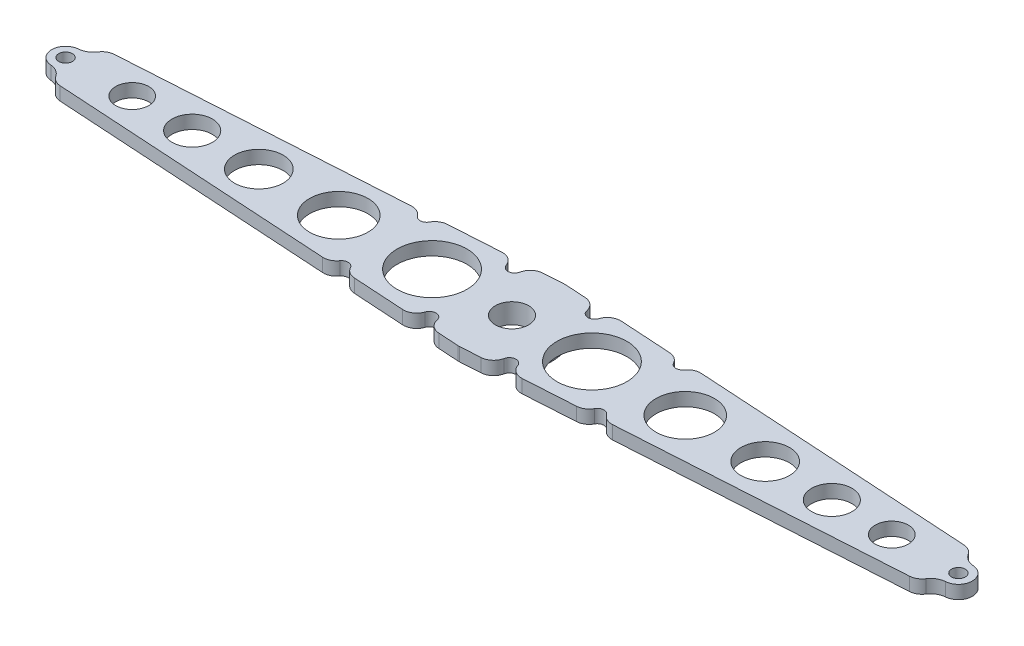
from build123d import *

# Parameters (mm, degrees)
SKETCH1_R                = 7.9375
BOSS_EXTRUDE1_DEPTH      = 9.525
F_5_16_18_TAPPED_HOLE1_D = 6.5278
SKETCH6_R                = 19.05
CUT_EXTRUDE2_DEPTH       = 3.175
CUT_EXTRUDE3_DEPTH       = 232.948907359
FILLET1_R                = 7.62
FILLET2_START            = 2
FILLET2_DEPTH            = 9
CUT_EXTRUDE4_REACH       = 224.817
FILLET3_R                = 6.35
CUT_EXTRUDE5_REACH       = 223
MIRROR3_COPY_1_REACH     = 223
FILLET4_R                = 6.35
CUT_EXTRUDE7_REACH       = 223
FILLET7_R                = 6.35
CUT_EXTRUDE8_REACH       = 222.999
SKETCH12_R               = 16.659587092
SKETCH12_R_2             = 13.926827849
SKETCH12_R_3             = 11.584462784
SKETCH12_R_4             = 9.632491896
SKETCH12_R_5             = 7.875718097


with BuildPart() as part:
    # Sketch1 → Boss-Extrude1 (new body)
    with BuildSketch(Plane(origin=(0, 0, 0), x_dir=(1, 0, 0), z_dir=(0, 1, 0))):
        with BuildLine():
            Line((0, 38.1), (-214.368307536, 15.789717076))
            ThreePointArc((-214.368307536, 15.789717076), (-228.6, 0), (-214.368307536, -15.789717076))
            Line((-214.368307536, -15.789717076), (0, -38.1))
            Line((0, -38.1), (214.368307536, -15.789717076))
            ThreePointArc((214.368307536, -15.789717076), (228.6, 0), (214.368307536, 15.789717076))
            Line((214.368307536, 15.789717076), (0, 38.1))
        make_face()
        with Locations(Location((0, 0, 0), (0, 0, 90))):
            Circle(SKETCH1_R, mode=Mode.SUBTRACT)
    extrude(amount=BOSS_EXTRUDE1_DEPTH)

    # 5/16-18 Tapped Hole1 (through all)
    with Locations(Plane(origin=(0, 9.525, 0), x_dir=(-1, 0, 0), z_dir=(0, 1, 0))):
        with Locations((212.725, 0), (-212.725, 0)):
            Hole(F_5_16_18_TAPPED_HOLE1_D / 2)

    # Sketch6 → Cut-Extrude2 (cut)
    with BuildSketch(Plane.XZ):
        with BuildLine():
            Line((214.368307536, 15.789717076), (0, 38.1))
            Line((0, 38.1), (-214.368307536, 15.789717076))
            ThreePointArc((-214.368307536, 15.789717076), (-228.6, 0), (-214.368307536, -15.789717076))
            Line((-214.368307536, -15.789717076), (0, -38.1))
            Line((0, -38.1), (214.368307536, -15.789717076))
            ThreePointArc((214.368307536, -15.789717076), (228.6, 0), (214.368307536, 15.789717076))
        make_face()
        with Locations(Location((0, 0, 0), (0, 0, 270))):
            Circle(SKETCH6_R, mode=Mode.SUBTRACT)
    extrude(amount=-CUT_EXTRUDE2_DEPTH, mode=Mode.SUBTRACT)

    # Sketch7 → Cut-Extrude3 (cut, through all)
    with BuildSketch(Plane(origin=(0, 9.525, 0), x_dir=(1, 0, 0), z_dir=(0, 1, 0))):
        with BuildLine():
            Line((-206.121, 16.648051811), (-206.121, 6.604))
            Line((-206.121, 6.604), (-212.725, 6.604))
            ThreePointArc((-212.725, 6.604), (-219.329, 0), (-212.725, -6.604))
            Line((-212.725, -6.604), (-206.121, -6.604))
            Line((-206.121, -6.604), (-206.121, -16.648051811))
            Line((-206.121, -16.648051811), (-214.368307536, -15.789717076))
            ThreePointArc((-214.368307536, -15.789717076), (-228.6, 0), (-214.368307536, 15.789717076))
            Line((-214.368307536, 15.789717076), (-206.121, 16.648051811))
        make_face()
    cut_extrude3 = extrude(amount=-CUT_EXTRUDE3_DEPTH, mode=Mode.SUBTRACT)

    # Mirror1: Cut-Extrude3 across plane
    add(cut_extrude3.mirror(Plane(origin=(0, 0, 0), x_dir=(0, 0, 1), z_dir=(1, 0, 0))), mode=Mode.SUBTRACT)

    # Fillet1
    fillet1_edges = [part.edges().sort_by_distance(p)[0] for p in [
        (-206.121, 6.35, 6.604),
        (-206.121, 6.35, -6.604),
        (206.121, 6.35, -6.604),
        (206.121, 6.35, 6.604),
    ]]
    fillet(fillet1_edges, radius=FILLET1_R)

    # Fillet2: read off the stored shape, not the designer's step
    # Fillet2 outline → Fillet2 (cut)
    with BuildSketch(Plane(origin=(0, 0, 0), x_dir=(1, 0, 0), z_dir=(0, 1, 0)).offset(FILLET2_START)):
        with BuildLine():
            ThreePointArc((-206.457327809, 11.94880223), (-204.013137198, 15.59583651), (-199.962443236, 17.289000771))
            Line((-199.962443236, 17.289000771), (-206.121, 16.648051811))
            Line((-206.121, 16.648051811), (-206.121, 14.187667884))
            ThreePointArc((-206.121, 14.187667884), (-206.205551039, 13.05567453), (-206.457327809, 11.94880223))
        make_face()
        with BuildLine():
            ThreePointArc((199.962443236, 17.289000771), (204.013137198, 15.59583651), (206.457327809, 11.94880223))
            ThreePointArc((206.457327809, 11.94880223), (206.205551039, 13.05567453), (206.121, 14.187667884))
            Line((206.121, 14.187667884), (206.121, 16.648051811))
            Line((206.121, 16.648051811), (199.962443236, 17.289000771))
        make_face()
        with BuildLine():
            Line((-206.121, -16.648051811), (-199.962443236, -17.289000771))
            ThreePointArc((-199.962443236, -17.289000771), (-204.013137198, -15.59583651), (-206.457327809, -11.94880223))
            ThreePointArc((-206.457327809, -11.94880223), (-206.205551039, -13.05567453), (-206.121, -14.187667884))
            Line((-206.121, -14.187667884), (-206.121, -16.648051811))
        make_face()
        with BuildLine():
            ThreePointArc((206.457327809, -11.94880223), (204.013137198, -15.59583651), (199.962443236, -17.289000771))
            Line((199.962443236, -17.289000771), (206.121, -16.648051811))
            Line((206.121, -16.648051811), (206.121, -14.187667884))
            ThreePointArc((206.121, -14.187667884), (206.205551039, -13.05567453), (206.457327809, -11.94880223))
        make_face()
    extrude(amount=FILLET2_DEPTH, mode=Mode.SUBTRACT)

    # Sketch9 → Cut-Extrude4 (cut, up to next)
    with BuildSketch(Plane(origin=(0, 9.525, 0), x_dir=(1, 0, 0), z_dir=(0, 1, 0)), mode=Mode.PRIVATE) as cut_extrude4_sk1:
        Polygon((122.02792385, -25.4), (-122.02792385, -25.4), (0, -38.1), align=None)
    cut_extrude4_tool1 = extrude(cut_extrude4_sk1.sketch, amount=-CUT_EXTRUDE4_REACH, mode=Mode.PRIVATE) & part.part
    # Sketch9 → Cut-Extrude4 (cut, up to next)
    with BuildSketch(Plane(origin=(0, 9.525, 0), x_dir=(1, 0, 0), z_dir=(0, 1, 0)), mode=Mode.PRIVATE) as cut_extrude4_sk2:
        Polygon((122.02792385, 25.4), (-122.02792385, 25.4), (0, 38.1), align=None)
    cut_extrude4_tool2 = extrude(cut_extrude4_sk2.sketch, amount=-CUT_EXTRUDE4_REACH, mode=Mode.PRIVATE) & part.part
    add(cut_extrude4_tool1.solids().sort_by_distance((0, 9.525, 29.633333))[0], mode=Mode.SUBTRACT)
    add(cut_extrude4_tool2.solids().sort_by_distance((0, 9.525, -29.633333))[0], mode=Mode.SUBTRACT)

    # Fillet3
    fillet3_edges = [part.edges().sort_by_distance(p)[0] for p in [
        (-122.02792385, 6.35, -25.4),
        (122.02792385, 6.35, -25.4),
        (122.02792385, 6.35, 25.4),
        (-122.02792385, 6.35, 25.4),
    ]]
    fillet(fillet3_edges, radius=FILLET3_R)

    # Sketch8 → Cut-Extrude5 (cut, up to next)
    with BuildSketch(Plane(origin=(0, 9.525, 0), x_dir=(1, 0, 0), z_dir=(0, 1, 0)), mode=Mode.PRIVATE) as cut_extrude5_sk1:
        with BuildLine():
            Line((-64.135, 20.32), (-64.135, 25.4))
            Line((-64.135, 25.4), (-57.785, 25.4))
            Line((-57.785, 25.4), (-57.785, 20.32))
            ThreePointArc((-57.785, 20.32), (-60.96, 17.145), (-64.135, 20.32))
        make_face()
    cut_extrude5_tool1 = extrude(cut_extrude5_sk1.sketch, amount=-CUT_EXTRUDE5_REACH, mode=Mode.PRIVATE) & part.part
    # Sketch8 → Cut-Extrude5 (cut, up to next)
    with BuildSketch(Plane(origin=(0, 9.525, 0), x_dir=(1, 0, 0), z_dir=(0, 1, 0)), mode=Mode.PRIVATE) as cut_extrude5_sk2:
        with BuildLine():
            Line((-22.225, 20.32), (-22.225, 25.4))
            Line((-22.225, 25.4), (-15.875, 25.4))
            Line((-15.875, 25.4), (-15.875, 20.32))
            ThreePointArc((-15.875, 20.32), (-19.05, 17.145), (-22.225, 20.32))
        make_face()
    cut_extrude5_tool2 = extrude(cut_extrude5_sk2.sketch, amount=-CUT_EXTRUDE5_REACH, mode=Mode.PRIVATE) & part.part
    # Sketch8 → Cut-Extrude5 (cut, up to next)
    with BuildSketch(Plane(origin=(0, 9.525, 0), x_dir=(1, 0, 0), z_dir=(0, 1, 0)), mode=Mode.PRIVATE) as cut_extrude5_sk3:
        with BuildLine():
            Line((-179.846550101, 19.382553089), (-185.655402545, 18.777999445))
            ThreePointArc((-185.655402545, 18.777999445), (-182.551338493, 17.162056585), (-179.846550101, 19.382553089))
        make_face()
    cut_extrude5_tool3 = extrude(cut_extrude5_sk3.sketch, amount=-CUT_EXTRUDE5_REACH, mode=Mode.PRIVATE) & part.part
    cut_extrude5_1 = cut_extrude5_tool1.solids().sort_by_distance((-60.96, 9.525, -21.580027))[0]
    add(cut_extrude5_1, mode=Mode.SUBTRACT)
    cut_extrude5_2 = cut_extrude5_tool2.solids().sort_by_distance((-19.05, 9.525, -21.580027))[0]
    add(cut_extrude5_2, mode=Mode.SUBTRACT)
    cut_extrude5_3 = cut_extrude5_tool3.solids().sort_by_distance((-182.668591, 9.525, -18.288679))[0]
    add(cut_extrude5_3, mode=Mode.SUBTRACT)
    cut_extrude5 = cut_extrude5_1 + cut_extrude5_2 + cut_extrude5_3  # Cut-Extrude5 as one shape, for the pattern or mirror that repeats it

    # Mirror2: Cut-Extrude5 across plane
    add(cut_extrude5.mirror(Plane(origin=(0, 0, 0), x_dir=(0, 0, 1), z_dir=(1, 0, 0))), mode=Mode.SUBTRACT)

    # Mirror3: Cut-Extrude5 across plane
    add(cut_extrude5.mirror(Plane.XY), mode=Mode.SUBTRACT)

    # Mirror3 copy 1 sketch → Mirror3 copy 1 (cut, up to next)
    with BuildSketch(Plane(origin=(0, 9.525, 0), x_dir=(-1, 0, 0), z_dir=(0, 1, 0)), mode=Mode.PRIVATE) as mirror3_copy_1_sk1:
        with BuildLine():
            Line((-64.135, 20.32), (-64.135, 25.4))
            Line((-64.135, 25.4), (-57.785, 25.4))
            Line((-57.785, 25.4), (-57.785, 20.32))
            ThreePointArc((-57.785, 20.32), (-60.96, 17.145), (-64.135, 20.32))
        make_face()
    mirror3_copy_1_tool1 = extrude(mirror3_copy_1_sk1.sketch, amount=-MIRROR3_COPY_1_REACH, mode=Mode.PRIVATE) & part.part
    # Mirror3 copy 1 sketch → Mirror3 copy 1 (cut, up to next)
    with BuildSketch(Plane(origin=(0, 9.525, 0), x_dir=(-1, 0, 0), z_dir=(0, 1, 0)), mode=Mode.PRIVATE) as mirror3_copy_1_sk2:
        with BuildLine():
            Line((-22.225, 20.32), (-22.225, 25.4))
            Line((-22.225, 25.4), (-15.875, 25.4))
            Line((-15.875, 25.4), (-15.875, 20.32))
            ThreePointArc((-15.875, 20.32), (-19.05, 17.145), (-22.225, 20.32))
        make_face()
    mirror3_copy_1_tool2 = extrude(mirror3_copy_1_sk2.sketch, amount=-MIRROR3_COPY_1_REACH, mode=Mode.PRIVATE) & part.part
    # Mirror3 copy 1 sketch → Mirror3 copy 1 (cut, up to next)
    with BuildSketch(Plane(origin=(0, 9.525, 0), x_dir=(-1, 0, 0), z_dir=(0, 1, 0)), mode=Mode.PRIVATE) as mirror3_copy_1_sk3:
        with BuildLine():
            Line((-179.846550101, 19.382553089), (-185.655402545, 18.777999445))
            ThreePointArc((-185.655402545, 18.777999445), (-182.551338493, 17.162056585), (-179.846550101, 19.382553089))
        make_face()
    mirror3_copy_1_tool3 = extrude(mirror3_copy_1_sk3.sketch, amount=-MIRROR3_COPY_1_REACH, mode=Mode.PRIVATE) & part.part
    add(mirror3_copy_1_tool1.solids().sort_by_distance((60.96, 9.525, 21.580027))[0], mode=Mode.SUBTRACT)
    add(mirror3_copy_1_tool2.solids().sort_by_distance((19.05, 9.525, 21.580027))[0], mode=Mode.SUBTRACT)
    add(mirror3_copy_1_tool3.solids().sort_by_distance((182.668591, 9.525, 18.288679))[0], mode=Mode.SUBTRACT)

    # Fillet4
    fillet4_edges = [part.edges().sort_by_distance(p)[0] for p in [
        (-15.875, 6.35, -25.4),
        (-22.225, 6.35, -25.4),
        (-57.785, 6.35, -25.4),
        (-64.135, 6.35, -25.4),
        (-185.655402545, 6.35, -18.777999445),
        (-179.846550101, 6.35, -19.382553089),
        (-179.846550101, 6.35, 19.382553089),
        (-185.655402545, 6.35, 18.777999445),
        (-57.785, 6.35, 25.4),
        (-64.135, 6.35, 25.4),
        (-15.875, 6.35, 25.4),
        (-22.225, 6.35, 25.4),
        (22.225, 6.35, 25.4),
        (15.875, 6.35, 25.4),
        (64.135, 6.35, 25.4),
        (57.785, 6.35, 25.4),
        (185.655402545, 6.35, 18.777999445),
        (179.846550101, 6.35, 19.382553089),
        (179.846550101, 6.35, -19.382553089),
        (185.655402545, 6.35, -18.777999445),
        (64.135, 6.35, -25.4),
        (57.785, 6.35, -25.4),
        (22.225, 6.35, -25.4),
        (15.875, 6.35, -25.4),
    ]]
    fillet(fillet4_edges, radius=FILLET4_R)

    # Sketch11 → Cut-Extrude7 (cut, up to next)
    with BuildSketch(Plane(origin=(0, 9.525, 0), x_dir=(1, 0, 0), z_dir=(0, 1, 0)), mode=Mode.PRIVATE) as cut_extrude7_sk1:
        with BuildLine():
            Line((-12.658744098, 24.620273065), (0, 25.4))
            Line((0, 25.4), (-9.610046345, 25.4))
            ThreePointArc((-9.610046345, 25.4), (-11.183460792, 25.201980736), (-12.658744098, 24.620273065))
        make_face()
    cut_extrude7_tool1 = extrude(cut_extrude7_sk1.sketch, amount=-CUT_EXTRUDE7_REACH, mode=Mode.PRIVATE) & part.part
    # Sketch11 → Cut-Extrude7 (cut, up to next)
    with BuildSketch(Plane(origin=(0, 9.525, 0), x_dir=(1, 0, 0), z_dir=(0, 1, 0)), mode=Mode.PRIVATE) as cut_extrude7_sk2:
        with BuildLine():
            Line((-57.206381926, 21.876320516), (-24.388531447, 23.897766071))
            ThreePointArc((-24.388531447, 23.897766071), (-26.306013929, 25.012625871), (-28.489953655, 25.4))
            Line((-28.489953655, 25.4), (-51.520046345, 25.4))
            ThreePointArc((-51.520046345, 25.4), (-54.864845646, 24.447667796), (-57.206381926, 21.876320516))
        make_face()
    cut_extrude7_tool2 = extrude(cut_extrude7_sk2.sketch, amount=-CUT_EXTRUDE7_REACH, mode=Mode.PRIVATE) & part.part
    # Sketch11 → Cut-Extrude7 (cut, up to next)
    with BuildSketch(Plane(origin=(0, 9.525, 0), x_dir=(1, 0, 0), z_dir=(0, 1, 0)), mode=Mode.PRIVATE) as cut_extrude7_sk3:
        with BuildLine():
            Line((-119.725598081, 18.025392143), (-64.511371572, 21.426362989))
            ThreePointArc((-64.511371572, 21.426362989), (-66.848010875, 24.313668159), (-70.399953655, 25.4))
            Line((-70.399953655, 25.4), (-121.698377155, 25.4))
            ThreePointArc((-121.698377155, 25.4), (-122.027480958, 25.391465973), (-122.355700169, 25.36588683))
            Line((-122.355700169, 25.36588683), (-177.035540335, 19.675107637))
            ThreePointArc((-177.035540335, 19.675107637), (-179.010961627, 19.137729041), (-180.712739107, 17.999740269))
            ThreePointArc((-180.712739107, 17.999740269), (-182.551338493, 17.162056585), (-184.523029766, 17.603186022))
            ThreePointArc((-184.523029766, 17.603186022), (-186.422669772, 18.366358927), (-188.466412312, 18.485444898))
            Line((-188.466412312, 18.485444898), (-199.962443236, 17.289000771))
            ThreePointArc((-199.962443236, 17.289000771), (-203.697537149, 15.841730432), (-206.182501509, 12.7))
            Line((-206.182501509, 12.7), (-119.725598081, 18.025392143))
        make_face()
    cut_extrude7_tool3 = extrude(cut_extrude7_sk3.sketch, amount=-CUT_EXTRUDE7_REACH, mode=Mode.PRIVATE) & part.part
    # Sketch11 → Cut-Extrude7 (cut, up to next)
    with BuildSketch(Plane(origin=(0, 9.525, 0), x_dir=(1, 0, 0), z_dir=(0, 1, 0)), mode=Mode.PRIVATE) as cut_extrude7_sk4:
        with BuildLine():
            Line((-123.816204979, -17.773427465), (-206.182501509, -12.7))
            ThreePointArc((-206.182501509, -12.7), (-203.697537149, -15.841730432), (-199.962443236, -17.289000771))
            Line((-199.962443236, -17.289000771), (-188.466412312, -18.485444898))
            ThreePointArc((-188.466412312, -18.485444898), (-186.422669772, -18.366358927), (-184.523029766, -17.603186022))
            ThreePointArc((-184.523029766, -17.603186022), (-182.551338493, -17.162056585), (-180.712739107, -17.999740269))
            ThreePointArc((-180.712739107, -17.999740269), (-179.010961627, -19.137729041), (-177.035540335, -19.675107637))
            Line((-177.035540335, -19.675107637), (-122.355700169, -25.36588683))
            ThreePointArc((-122.355700169, -25.36588683), (-122.027480958, -25.391465973), (-121.698377155, -25.4))
            Line((-121.698377155, -25.4), (-70.399953655, -25.4))
            ThreePointArc((-70.399953655, -25.4), (-66.848010875, -24.313668159), (-64.511371572, -21.426362989))
            Line((-64.511371572, -21.426362989), (-123.816204979, -17.773427465))
        make_face()
    cut_extrude7_tool4 = extrude(cut_extrude7_sk4.sketch, amount=-CUT_EXTRUDE7_REACH, mode=Mode.PRIVATE) & part.part
    # Sketch11 → Cut-Extrude7 (cut, up to next)
    with BuildSketch(Plane(origin=(0, 9.525, 0), x_dir=(1, 0, 0), z_dir=(0, 1, 0)), mode=Mode.PRIVATE) as cut_extrude7_sk5:
        with BuildLine():
            Line((-24.388531447, -23.897766071), (-57.206381926, -21.876320516))
            ThreePointArc((-57.206381926, -21.876320516), (-54.864845646, -24.447667796), (-51.520046345, -25.4))
            Line((-51.520046345, -25.4), (-28.489953655, -25.4))
            ThreePointArc((-28.489953655, -25.4), (-26.306013929, -25.012625871), (-24.388531447, -23.897766071))
        make_face()
    cut_extrude7_tool5 = extrude(cut_extrude7_sk5.sketch, amount=-CUT_EXTRUDE7_REACH, mode=Mode.PRIVATE) & part.part
    # Sketch11 → Cut-Extrude7 (cut, up to next)
    with BuildSketch(Plane(origin=(0, 9.525, 0), x_dir=(1, 0, 0), z_dir=(0, 1, 0)), mode=Mode.PRIVATE) as cut_extrude7_sk6:
        with BuildLine():
            Line((0, -25.4), (-12.658744098, -24.620273065))
            ThreePointArc((-12.658744098, -24.620273065), (-11.183460792, -25.201980736), (-9.610046345, -25.4))
            Line((-9.610046345, -25.4), (0, -25.4))
        make_face()
    cut_extrude7_tool6 = extrude(cut_extrude7_sk6.sketch, amount=-CUT_EXTRUDE7_REACH, mode=Mode.PRIVATE) & part.part
    cut_extrude7_1 = cut_extrude7_tool1.solids().sort_by_distance((-7.796401, 9.525, -25.134775))[0]
    add(cut_extrude7_1, mode=Mode.SUBTRACT)
    cut_extrude7_2 = cut_extrude7_tool2.solids().sort_by_distance((-42.473667, 9.525, -24.026292))[0]
    add(cut_extrude7_2, mode=Mode.SUBTRACT)
    cut_extrude7_3 = cut_extrude7_tool3.solids().sort_by_distance((-133.253815, 9.525, -20.136614))[0]
    add(cut_extrude7_3, mode=Mode.SUBTRACT)
    cut_extrude7_4 = cut_extrude7_tool4.solids().sort_by_distance((-133.253815, 9.525, 20.136614))[0]
    add(cut_extrude7_4, mode=Mode.SUBTRACT)
    cut_extrude7_5 = cut_extrude7_tool5.solids().sort_by_distance((-42.473667, 9.525, 24.026292))[0]
    add(cut_extrude7_5, mode=Mode.SUBTRACT)
    cut_extrude7_6 = cut_extrude7_tool6.solids().sort_by_distance((-7.796401, 9.525, 25.134775))[0]
    add(cut_extrude7_6, mode=Mode.SUBTRACT)
    cut_extrude7 = cut_extrude7_1 + cut_extrude7_2 + cut_extrude7_3 + cut_extrude7_4 + cut_extrude7_5 + cut_extrude7_6  # Cut-Extrude7 as one shape, for the pattern or mirror that repeats it

    # Mirror5: Cut-Extrude7 across plane
    add(cut_extrude7.mirror(Plane(origin=(0, 0, 0), x_dir=(0, 0, 1), z_dir=(1, 0, 0))), mode=Mode.SUBTRACT)

    # Fillet7
    # the kernel refuses this fillet: 6.35 mm, written as the material it takes off along each edge
    with BuildSketch(Plane(origin=(206.182501509, 18.98657134, 12.7), x_dir=(0.4011649267675749, 0, -0.9160058414287358), z_dir=(0, -1, 0)), Plane(origin=(-206.182501509, 18.98657134, -12.7), x_dir=(-0.4011649267675745, 0, 0.916005841428736), z_dir=(0, -1, 0))) as fillet7_piece_1:
        with BuildLine():
            CenterArc((3.920500197, -6.267024123), FILLET7_R, 99.272583276, 53.551659996)
            Line((-1.728521418, -3.366842269), (-2.29342358, -3.076824083))
            Line((-2.29342358, -3.076824083), (-0.564902162, 0.290018185))
            Line((-0.564902162, 0.290018185), (0.006065632, 0.634971029))
            ThreePointArc((0.006065632, 0.634971029), (0.870947201, 0.581225019), (2.794996109, 0.626702412))
            Line((2.794996109, 0.626702412), (2.897314662, 0))
        make_face()
    extrude(amount=25.27314268, mode=Mode.SUBTRACT)
    with BuildSketch(Plane(origin=(206.182501509, 18.98657134, -12.7), x_dir=(-0.9981083526436348, 0, -0.06147939803714307), z_dir=(0, -1, 0)), Plane(origin=(-206.182501509, 18.98657134, 12.7), x_dir=(0.9981083526436348, 0, 0.06147939803714309), z_dir=(0, -1, 0))) as fillet7_piece_2:
        with BuildLine():
            CenterArc((3.784628536, -6.35), FILLET7_R, 90, 53.551659996)
            Line((-1.323266049, -2.577479237), (-1.834055508, -2.200227161))
            ThreePointArc((-1.834055508, -2.200227161), (-0.914843774, -0.509345089), (-0.567646694, 0.284608909))
            Line((-0.567646694, 0.284608909), (0, 0.635))
            Line((0, 0.635), (3.784628536, 0.635))
            Line((3.784628536, 0.635), (3.784628536, 0))
        make_face()
    extrude(amount=25.27314268, mode=Mode.SUBTRACT)
    with BuildSketch(Plane(origin=(64.511371572, 21.058850731, 21.426362989), x_dir=(0.9981083526436348, 0, -0.061479398037142925), z_dir=(0, -1, 0))) as fillet7_piece_3:
        with BuildLine():
            CenterArc((4.613540292, -6.35), FILLET7_R, 90, 58.142371333)
            Line((-0.779909968, -2.998404218), (-1.319254994, -2.66324464))
            ThreePointArc((-1.319254994, -2.66324464), (-0.943254985, -1.505868978), (-0.602354033, 0.200984127))
            Line((-0.602354033, 0.200984127), (0, 0.635))
            Line((0, 0.635), (4.613540292, 0.635))
            Line((4.613540292, 0.635), (4.613540292, 0))
        make_face()
    extrude(amount=29.417701461, mode=Mode.SUBTRACT)
    with BuildSketch(Plane(origin=(57.206381926, 20.144940477, 21.876320516), x_dir=(0.29876629636204993, 0, -0.9543263069611483), z_dir=(0, -1, 0)), Plane(origin=(-57.206381926, 20.144940477, -21.876320516), x_dir=(-0.2987662963620492, 0, 0.9543263069611485), z_dir=(0, -1, 0))) as fillet7_piece_4:
        with BuildLine():
            CenterArc((4.415886032, -6.234400715), FILLET7_R, 100.949376744, 58.142371333)
            Line((-1.515986065, -3.968260068), (-2.109173274, -3.741646003))
            Line((-2.109173274, -3.741646003), (-0.59318721, 0.226614065))
            Line((-0.59318721, 0.226614065), (-0.09983466, 0.627102895))
            ThreePointArc((-0.09983466, 0.627102895), (2.177800026, 0.613672543), (3.089143874, 0.623440071))
            Line((3.089143874, 0.623440071), (3.209756798, 0))
        make_face()
    extrude(amount=27.589880953, mode=Mode.SUBTRACT)
    with BuildSketch(Plane(origin=(64.511371572, 21.058850731, -21.426362989), x_dir=(-0.31075545640432495, 0, 0.9504898980604369), z_dir=(0, -1, 0)), Plane(origin=(-64.511371572, 21.058850731, 21.426362989), x_dir=(0.3107554564043287, 0, -0.9504898980604356), z_dir=(0, -1, 0))) as fillet7_piece_5:
        with BuildLine():
            CenterArc((4.984134679, -6.063468935), FILLET7_R, 107.277597809, 58.142371333)
            Line((-1.161376047, -4.464970292), (-1.77592712, -4.305120427))
            Line((-1.77592712, -4.305120427), (-0.614551073, 0.159849864))
            Line((-0.614551073, 0.159849864), (-0.04288, 0.633550555))
            ThreePointArc((-0.04288, 0.633550555), (1.694822956, 0.533803797), (2.909578869, 0.606346894))
            Line((2.909578869, 0.606346894), (3.098174852, 0))
        make_face()
    extrude(amount=29.417701461, mode=Mode.SUBTRACT)
    with BuildSketch(Plane(origin=(57.206381926, 20.144940477, -21.876320516), x_dir=(-0.9981083526436348, 0, -0.061479398037143584), z_dir=(0, -1, 0)), Plane(origin=(-57.206381926, 20.144940477, 21.876320516), x_dir=(0.9981083526436348, 0, 0.06147939803714285), z_dir=(0, -1, 0))) as fillet7_piece_6:
        with BuildLine():
            CenterArc((4.247976191, -6.35), FILLET7_R, 90, 58.142371333)
            Line((-1.14547407, -2.998404218), (-1.684819096, -2.66324464))
            ThreePointArc((-1.684819096, -2.66324464), (-1.350461132, -1.815395734), (-0.550181856, 0.31705666))
            Line((-0.550181856, 0.31705666), (0, 0.635))
            Line((0, 0.635), (4.247976191, 0.635))
            Line((4.247976191, 0.635), (4.247976191, 0))
        make_face()
    extrude(amount=27.589880953, mode=Mode.SUBTRACT)
    with BuildSketch(Plane(origin=(24.388531447, 22.371468705, -23.897766071), x_dir=(-0.45274265275182435, 0, 0.8916412341178717), z_dir=(0, -1, 0)), Plane(origin=(-24.388531447, 22.371468705, 23.897766071), x_dir=(0.45274265275182174, 0, -0.8916412341178728), z_dir=(0, -1, 0))) as fillet7_piece_7:
        with BuildLine():
            CenterArc((4.201633158, -6.280494932), FILLET7_R, 81.514920071, 75.090026426)
            Line((-1.626326415, -3.759108961), (-2.209122372, -3.506970363))
            Line((-2.209122372, -3.506970363), (-0.582795957, 0.252138597))
            Line((-0.582795957, 0.252138597), (-0.246557935, 0.585178763))
            ThreePointArc((-0.246557935, 0.585178763), (4.769335233, 0.742371441), (5.232282914, 0.628049493))
            Line((5.232282914, 0.628049493), (5.138587482, 0))
        make_face()
    extrude(amount=32.042937409, mode=Mode.SUBTRACT)
    with BuildSketch(Plane(origin=(0, 10.502835163, 25.4), x_dir=(0.998108352643634, 0, -0.061479398037158), z_dir=(0, -1, 0)), Plane(origin=(0, 10.502835163, -25.4), x_dir=(-0.9981083526436356, 0, 0.061479398037131115), z_dir=(0, -1, 0))) as fillet7_piece_8:
        with BuildLine():
            CenterArc((FILLET7_R * 0.0615959157884, -FILLET7_R), FILLET7_R, 90, 7.049465664)
            Line((-FILLET7_R * 0.0611302856043, -FILLET7_R * 0.00755943276602), (0, 0))
            Line((0, 0), (FILLET7_R * 0.0615959157884, 0))
        make_face()
    extrude(amount=8.305670326, mode=Mode.SUBTRACT)
    with BuildSketch(Plane(origin=(12.658744098, 24.320639191, -24.620273065), x_dir=(-0.9981083526436348, 0, -0.06147939803714439), z_dir=(0, -1, 0)), Plane(origin=(-12.658744098, 24.320639191, 24.620273065), x_dir=(0.9981083526436348, 0, 0.06147939803714225), z_dir=(0, -1, 0))) as fillet7_piece_9:
        with BuildLine():
            CenterArc((2.560761582, -6.35), FILLET7_R, 90, 75.090026426)
            Line((-3.575442205, -4.716138599), (-4.189062584, -4.552752459))
            ThreePointArc((-4.189062584, -4.552752459), (-4.151806031, -4.391997306), (-0.270047366, 0.574716817))
            Line((-0.270047366, 0.574716817), (0, 0.635))
            Line((0, 0.635), (2.560761582, 0.635))
            Line((2.560761582, 0.635), (2.560761582, 0))
        make_face()
    extrude(amount=35.941278382, mode=Mode.SUBTRACT)
    with BuildSketch(Plane(origin=(24.388531447, 22.371468705, 23.897766071), x_dir=(0.9981083526436347, 0, -0.0614793980371442), z_dir=(0, -1, 0)), Plane(origin=(-24.388531447, 22.371468705, -23.897766071), x_dir=(-0.998108352643635, 0, 0.06147939803714275), z_dir=(0, -1, 0))) as fillet7_piece_10:
        with BuildLine():
            CenterArc((4.095831757, -6.35), FILLET7_R, 90, 75.090026426)
            Line((-2.04037203, -4.716138599), (-2.653992409, -4.552752459))
            ThreePointArc((-2.653992409, -4.552752459), (-2.57509381, -4.082470549), (-0.43917015, 0.458644284))
            Line((-0.43917015, 0.458644284), (0, 0.635))
            Line((0, 0.635), (4.095831757, 0.635))
            Line((4.095831757, 0.635), (4.095831757, 0))
        make_face()
    extrude(amount=32.042937409, mode=Mode.SUBTRACT)
    with BuildSketch(Plane(origin=(12.658744098, 24.320639191, 24.620273065), x_dir=(0.5540033325132365, 0, -0.8325144488621373), z_dir=(0, -1, 0)), Plane(origin=(-12.658744098, 24.320639191, -24.620273065), x_dir=(-0.5540033325132382, 0, 0.8325144488621363), z_dir=(0, -1, 0))) as fillet7_piece_11:
        with BuildLine():
            CenterArc((3.513133971, -5.876894553), FILLET7_R, 67.743146535, 75.090026426)
            Line((-1.547052973, -2.040619264), (-2.053071667, -1.656991735))
            Line((-2.053071667, -1.656991735), (-0.506018694, 0.383627529))
            Line((-0.506018694, 0.383627529), (-0.29483441, 0.562403477))
            ThreePointArc((-0.29483441, 0.562403477), (6.008157213, 0.655118731), (6.158767847, 0.587689455))
            Line((6.158767847, 0.587689455), (5.918255676, 0))
        make_face()
    extrude(amount=35.941278382, mode=Mode.SUBTRACT)
    with BuildSketch(Plane(origin=(-64.511371572, 21.058850731, -21.426362989), x_dir=(0.31075545640432495, 0, 0.9504898980604369), z_dir=(0, -1, 0))) as fillet7_piece_12:
        with BuildLine():
            CenterArc((4.984134679, 6.063468935), FILLET7_R, 194.580030858, 58.142371333)
            Line((-1.161376047, 4.464970292), (-1.77592712, 4.305120427))
            Line((-1.77592712, 4.305120427), (-0.614551073, -0.159849864))
            Line((-0.614551073, -0.159849864), (-0.04288, -0.633550555))
            ThreePointArc((-0.04288, -0.633550555), (1.694822956, -0.533803797), (2.909578869, -0.606346894))
            Line((2.909578869, -0.606346894), (3.098174852, 0))
        make_face()
    extrude(amount=29.417701461, mode=Mode.SUBTRACT)

    # Sketch12 → Cut-Extrude8 (cut, up to next)
    with BuildSketch(Plane(origin=(0, 9.525, 0), x_dir=(1, 0, 0), z_dir=(0, 1, 0)), mode=Mode.PRIVATE) as cut_extrude8_sk1:
        with Locations(Location((-38.1, 0, 0), (0, 0, 270))):
            Circle(SKETCH12_R)
    cut_extrude8_tool1 = extrude(cut_extrude8_sk1.sketch, amount=-CUT_EXTRUDE8_REACH, mode=Mode.PRIVATE) & part.part
    # Sketch12 → Cut-Extrude8 (cut, up to next)
    with BuildSketch(Plane(origin=(0, 9.525, 0), x_dir=(1, 0, 0), z_dir=(0, 1, 0)), mode=Mode.PRIVATE) as cut_extrude8_sk2:
        with Locations(Location((-82.55, 0, 0), (0, 0, 270))):
            Circle(SKETCH12_R_2)
    cut_extrude8_tool2 = extrude(cut_extrude8_sk2.sketch, amount=-CUT_EXTRUDE8_REACH, mode=Mode.PRIVATE) & part.part
    # Sketch12 → Cut-Extrude8 (cut, up to next)
    with BuildSketch(Plane(origin=(0, 9.525, 0), x_dir=(1, 0, 0), z_dir=(0, 1, 0)), mode=Mode.PRIVATE) as cut_extrude8_sk3:
        with Locations(Location((-120.65, 0, 0), (0, 0, 270))):
            Circle(SKETCH12_R_3)
    cut_extrude8_tool3 = extrude(cut_extrude8_sk3.sketch, amount=-CUT_EXTRUDE8_REACH, mode=Mode.PRIVATE) & part.part
    # Sketch12 → Cut-Extrude8 (cut, up to next)
    with BuildSketch(Plane(origin=(0, 9.525, 0), x_dir=(1, 0, 0), z_dir=(0, 1, 0)), mode=Mode.PRIVATE) as cut_extrude8_sk4:
        with Locations(Location((-152.4, 0, 0), (0, 0, 270))):
            Circle(SKETCH12_R_4)
    cut_extrude8_tool4 = extrude(cut_extrude8_sk4.sketch, amount=-CUT_EXTRUDE8_REACH, mode=Mode.PRIVATE) & part.part
    # Sketch12 → Cut-Extrude8 (cut, up to next)
    with BuildSketch(Plane(origin=(0, 9.525, 0), x_dir=(1, 0, 0), z_dir=(0, 1, 0)), mode=Mode.PRIVATE) as cut_extrude8_sk5:
        with Locations(Location((-180.975, 0, 0), (0, 0, 270))):
            Circle(SKETCH12_R_5)
    cut_extrude8_tool5 = extrude(cut_extrude8_sk5.sketch, amount=-CUT_EXTRUDE8_REACH, mode=Mode.PRIVATE) & part.part
    cut_extrude8_1 = cut_extrude8_tool1.solids().sort_by_distance((-38.1, 9.525, 0))[0]
    add(cut_extrude8_1, mode=Mode.SUBTRACT)
    cut_extrude8_2 = cut_extrude8_tool2.solids().sort_by_distance((-82.55, 9.525, 0))[0]
    add(cut_extrude8_2, mode=Mode.SUBTRACT)
    cut_extrude8_3 = cut_extrude8_tool3.solids().sort_by_distance((-120.65, 9.525, 0))[0]
    add(cut_extrude8_3, mode=Mode.SUBTRACT)
    cut_extrude8_4 = cut_extrude8_tool4.solids().sort_by_distance((-152.4, 9.525, 0))[0]
    add(cut_extrude8_4, mode=Mode.SUBTRACT)
    cut_extrude8_5 = cut_extrude8_tool5.solids().sort_by_distance((-180.975, 9.525, 0))[0]
    add(cut_extrude8_5, mode=Mode.SUBTRACT)
    cut_extrude8 = cut_extrude8_1 + cut_extrude8_2 + cut_extrude8_3 + cut_extrude8_4 + cut_extrude8_5  # Cut-Extrude8 as one shape, for the pattern or mirror that repeats it

    # Mirror6: Cut-Extrude8 across plane
    add(cut_extrude8.mirror(Plane(origin=(0, 0, 0), x_dir=(0, 0, 1), z_dir=(1, 0, 0))), mode=Mode.SUBTRACT)


solid = part.part
